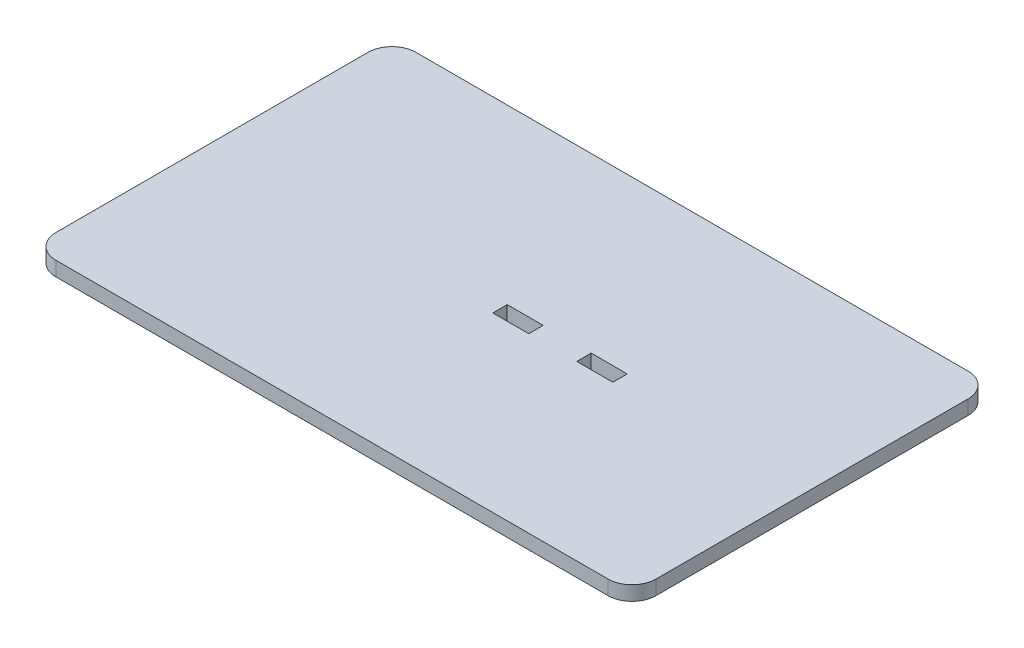
from build123d import *

# Parameters (mm, degrees)
ESQUISSE1_W            = 250
ESQUISSE1_H            = 150
BOSS_EXTRU_1_DEPTH     = 6
EMPREINTE1_START       = 21.035502959
EMPREINTE1_OUTLINE_W   = 6
EMPREINTE1_OUTLINE_H   = 6
EMPREINTE1_DEPTH       = 15
EMPREINTE1_START_2     = 56.035502959
EMPREINTE1_2_OUTLINE_W = 6
EMPREINTE1_2_OUTLINE_H = 6
EMPREINTE1_2_DEPTH     = 15
CONG_1_R               = 10


# Read off the part's stored shape, not the designer's step: Empreinte1
with BuildPart() as part:
    # Esquisse1 → Boss.-Extru.1 (new body)
    with BuildSketch(Plane(origin=(0, 0, 0), x_dir=(1, 0, 0), z_dir=(0, 1, 0))):
        with Locations((26.035502959, -13.979289941)):
            Rectangle(ESQUISSE1_W, ESQUISSE1_H)
    extrude(amount=BOSS_EXTRU_1_DEPTH)

    # Empreinte1 outline → Empreinte1 (cut)
    with BuildSketch(Plane.YZ.offset(EMPREINTE1_START)):
        with Locations((3, 13.979289941)):
            Rectangle(EMPREINTE1_OUTLINE_W, EMPREINTE1_OUTLINE_H)
    extrude(amount=EMPREINTE1_DEPTH, mode=Mode.SUBTRACT)

    # Empreinte1 2 outline → Empreinte1 2 (cut)
    with BuildSketch(Plane.YZ.offset(EMPREINTE1_START_2)):
        with Locations((3, 13.979289941)):
            Rectangle(EMPREINTE1_2_OUTLINE_W, EMPREINTE1_2_OUTLINE_H)
    extrude(amount=EMPREINTE1_2_DEPTH, mode=Mode.SUBTRACT)

    # Congé1
    cong_1_edges = [part.edges().sort_by_distance(p)[0] for p in [
        (-98.964497041, 3, -61.020710059),
        (151.035502959, 3, -61.020710059),
        (151.035502959, 3, 88.979289941),
        (-98.964497041, 3, 88.979289941),
    ]]
    fillet(cong_1_edges, radius=CONG_1_R)


solid = part.part
